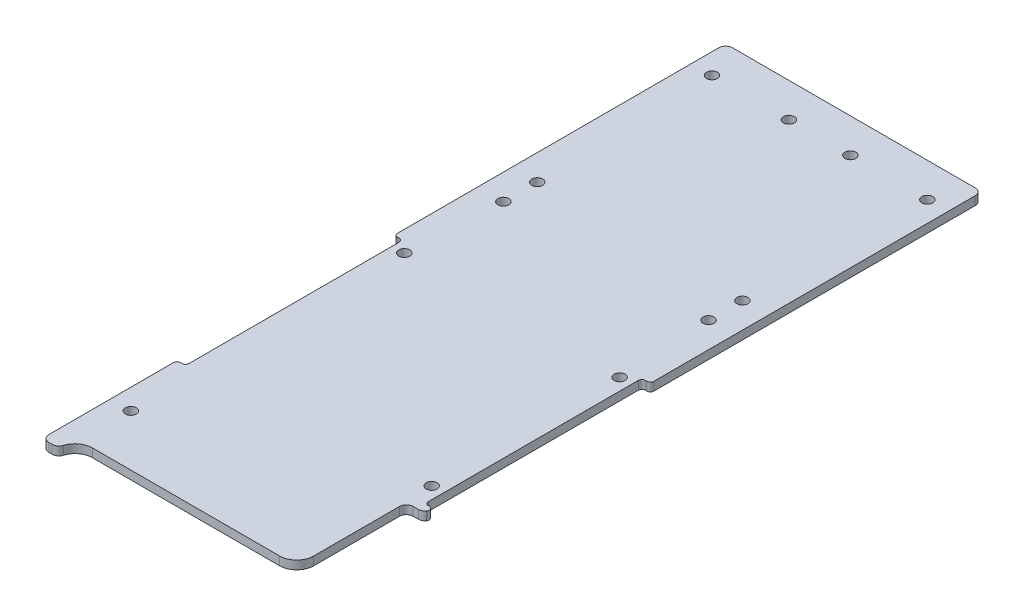
from build123d import *

# Parameters (mm, degrees)
SKETCH1_R               = 2.032
BOSS_EXTRUDE1_DEPTH     = 3.175
FILLET1_R               = 2.54
FILLET2_R               = 2.54
FILLET3_R               = 6.35
CUT_EXTRUDE1_DEPTH      = 136.673215063
FILLET4_R               = 6.35
FILLET5_R               = 2.54
SKETCH3_R               = 2.032
CUT_EXTRUDE2_DEPTH      = 136.673215063
CUT_EXTRUDE3_DEPTH      = 136.673215063
CUT_EXTRUDE3_DEPTH_BACK = 136.673215063
SKETCH4_W               = 3.175
SKETCH4_H               = 80.645
FILLET6_R               = 1.27


with BuildPart() as part:
    # Sketch1 → Boss-Extrude1 (new body)
    with BuildSketch(Plane(origin=(0, 0, 0), x_dir=(1, 0, 0), z_dir=(0, 1, 0))):
        Polygon((47.625, 127), (-47.625, 127), (-47.625, -127), (-41.275, -127), (-41.275, -120.65), (41.275, -120.65), (41.275, -127), (47.625, -127), align=None)
        with Locations((-39.999684148, -101.6)):
            Circle(SKETCH1_R, mode=Mode.SUBTRACT)
        with Locations((39.999684148, -69.85)):
            Circle(SKETCH1_R, mode=Mode.SUBTRACT)
        with Locations((-39.999684148, 0)):
            Circle(SKETCH1_R, mode=Mode.SUBTRACT)
        with Locations((-39.999684148, 114.3)):
            Circle(SKETCH1_R, mode=Mode.SUBTRACT)
        with Locations((-11.424684148, 114.3)):
            Circle(SKETCH1_R, mode=Mode.SUBTRACT)
        with Locations((39.999684148, 0)):
            Circle(SKETCH1_R, mode=Mode.SUBTRACT)
        with Locations((11.424684148, 114.3)):
            Circle(SKETCH1_R, mode=Mode.SUBTRACT)
        with Locations((39.999684148, 114.3)):
            Circle(SKETCH1_R, mode=Mode.SUBTRACT)
    extrude(amount=BOSS_EXTRUDE1_DEPTH)

    # Fillet1
    fillet1_edges = [part.edges().sort_by_distance(p)[0] for p in [
        (-47.625, 1.5875, -127),
        (47.625, 1.5875, -127),
        (47.625, 1.5875, 127),
        (-47.625, 1.5875, 127),
    ]]
    fillet(fillet1_edges, radius=FILLET1_R)

    # Fillet2
    fillet2_edges = [part.edges().sort_by_distance(p)[0] for p in [
        (41.275, 1.5875, 127),
        (-41.275, 1.5875, 127),
    ]]
    fillet(fillet2_edges, radius=FILLET2_R)

    # Fillet3
    fillet3_edges = [part.edges().sort_by_distance(p)[0] for p in [
        (41.275, 1.5875, 120.65),
        (-41.275, 1.5875, 120.65),
    ]]
    fillet(fillet3_edges, radius=FILLET3_R)

    # Sketch2 → Cut-Extrude1 (cut, through all)
    with BuildSketch(Plane.XZ):
        with BuildLine():
            Line((40.64508, 123.578690235), (40.64508, 79.88808))
            Line((40.64508, 79.88808), (47.625, 79.88808))
            Line((47.625, 79.88808), (47.625, 124.46))
            ThreePointArc((47.625, 124.46), (46.881051224, 126.256051224), (45.085, 127))
            Line((45.085, 127), (43.815, 127))
            ThreePointArc((43.815, 127), (42.297059666, 126.496530663), (41.380880287, 125.185714286))
            ThreePointArc((41.380880287, 125.185714286), (41.069166069, 124.356476684), (40.64508, 123.578690235))
        make_face()
    extrude(amount=-CUT_EXTRUDE1_DEPTH, mode=Mode.SUBTRACT)

    # Fillet4
    fillet4_edges = [part.edges().sort_by_distance(p)[0] for p in [
        (40.64508, 1.5875, 123.578690235),
    ]]
    fillet(fillet4_edges, radius=FILLET4_R)

    # Fillet5
    fillet5_edges = [part.edges().sort_by_distance(p)[0] for p in [
        (47.625, 1.5875, 79.88808),
        (40.64508, 1.5875, 79.88808),
    ]]
    fillet(fillet5_edges, radius=FILLET5_R)

    # Sketch3 → Cut-Extrude2 (cut, through all)
    with BuildSketch(Plane.XZ):
        with Locations((-38.104089969, -34.913768806)):
            Circle(SKETCH3_R)
        with Locations((-38.104089969, -47.490173279)):
            Circle(SKETCH3_R)
        with Locations((38.104089969, -47.490173279)):
            Circle(SKETCH3_R)
        with Locations((38.104089969, -34.913768806)):
            Circle(SKETCH3_R)
    extrude(amount=-CUT_EXTRUDE2_DEPTH, mode=Mode.SUBTRACT)

    # Sketch4 → Cut-Extrude3 (cut, two sides: drawn at the far end of the back side and taken through both)
    with BuildSketch(Plane(origin=(0, 3.175, 0), x_dir=(1, 0, 0), z_dir=(0, 1, 0)).offset(-CUT_EXTRUDE3_DEPTH_BACK)):
        with Locations((-46.0375, -36.5125)):
            Rectangle(SKETCH4_W, SKETCH4_H)
        with Locations((46.0375, -36.5125)):
            Rectangle(SKETCH4_W, SKETCH4_H)
    extrude(amount=CUT_EXTRUDE3_DEPTH + CUT_EXTRUDE3_DEPTH_BACK, mode=Mode.SUBTRACT)

    # Fillet6
    fillet6_edges = [part.edges().sort_by_distance(p)[0] for p in [
        (-44.45, 1.5875, -3.81),
        (-47.625, 1.5875, -3.81),
        (-47.625, 1.5875, 76.835),
        (-44.45, 1.5875, 76.835),
        (44.45, 1.5875, 76.835),
        (47.625, 1.5875, 76.835),
        (44.45, 1.5875, -3.81),
        (47.625, 1.5875, -3.81),
    ]]
    fillet(fillet6_edges, radius=FILLET6_R)


solid = part.part
